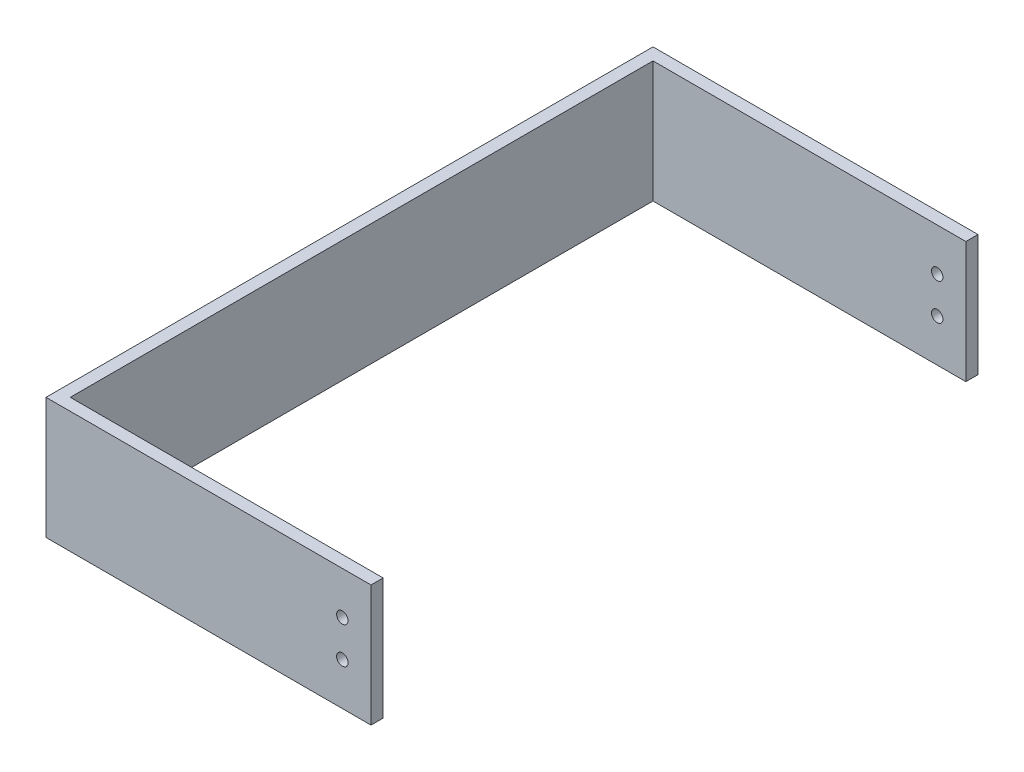
from build123d import *

# Parameters (mm, degrees)
BOSS_EXTRUDE1_DEPTH = 31.75
SKETCH2_R           = 1.5
CUT_EXTRUDE1_DEPTH  = 183.851374072


with BuildPart() as part:
    # Sketch1 → Boss-Extrude1 (new body)
    with BuildSketch(Plane(origin=(0, 0, 0), x_dir=(1, 0, 0), z_dir=(0, 1, 0))):
        Polygon((0, 0), (-85, 0), (-85, 158.75), (0, 158.75), (0, 155.575), (-81.825, 155.575), (-81.825, 3.175), (0, 3.175), align=None)
    extrude(amount=BOSS_EXTRUDE1_DEPTH)

    # Sketch2 → Cut-Extrude1 (cut, through all)
    with BuildSketch(Plane.XY):
        with Locations((-7.5, 20.6375)):
            Circle(SKETCH2_R)
        with Locations((-7.5, 11.1125)):
            Circle(SKETCH2_R)
    extrude(amount=-CUT_EXTRUDE1_DEPTH, mode=Mode.SUBTRACT)


solid = part.part
